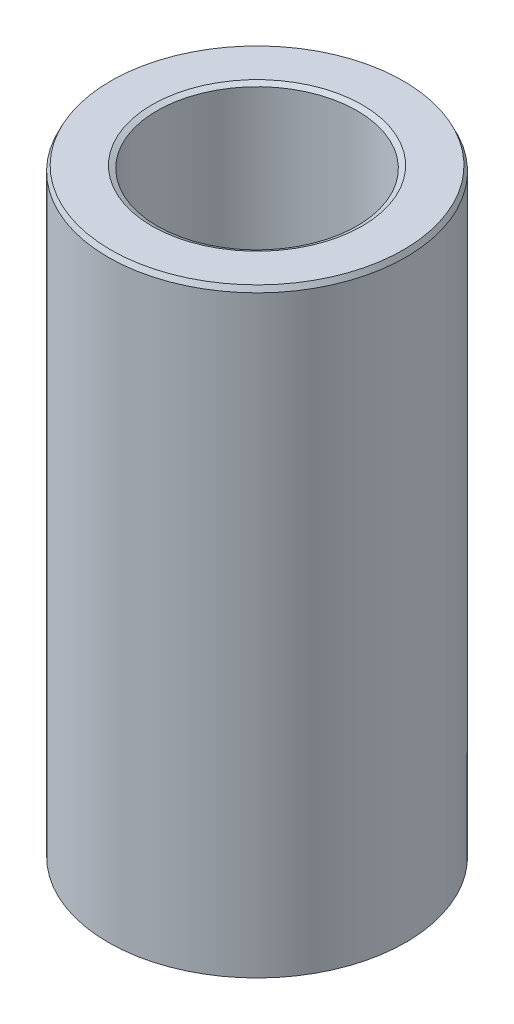
from build123d import *
from OCP.BRepFilletAPI import BRepFilletAPI_MakeChamfer

# Parameters (mm, degrees)
SKETCH1_R           = 50
BOSS_EXTRUDE1_DEPTH = 201.895542039
SKETCH2_R           = 33.577396737
CUT_EXTRUDE1_DEPTH  = 214.920101662
CHAMFER1_SIZE       = 1.7305693
CHAMFER1_SIZE2      = 0.84217697


with BuildPart() as part:
    # Sketch1 → Boss-Extrude1 (new body)
    with BuildSketch(Plane(origin=(0, 0, 0), x_dir=(1, 0, 0), z_dir=(0, 1, 0))):
        Circle(SKETCH1_R)
    extrude(amount=BOSS_EXTRUDE1_DEPTH)

    # Sketch2 → Cut-Extrude1 (cut, through all)
    with BuildSketch(Plane(origin=(0, 0, 0), x_dir=(1, 0, 0), z_dir=(0, 1, 0))):
        Circle(SKETCH2_R)
    extrude(amount=CUT_EXTRUDE1_DEPTH, mode=Mode.SUBTRACT)

    # Chamfer1: one chamfer whose edges measure the first distance from different faces: ONE call of the kernel's chamfer builder (chamfer() names one face for all edges)
    chamfer1_edges_1 = [part.edges().sort_by_distance(p)[0] for p in [
        (-33.577396737, 201.895542039, 0),
    ]]
    chamfer1_side_1 = [part.faces().sort_by_distance(p)[0] for p in [
        (-48.585786438, 201.895542039, 0),
    ]]
    chamfer1_edges_2 = [part.edges().sort_by_distance(p)[0] for p in [
        (-33.577396737, 0, 0),
    ]]
    chamfer1_side_2 = [part.faces().sort_by_distance(p)[0] for p in [
        (-33.577396737, 100.947771019, 0),
    ]]
    chamfer1_edges_3 = [part.edges().sort_by_distance(p)[0] for p in [
        (-50, 0, 0),
    ]]
    chamfer1_side_3 = [part.faces().sort_by_distance(p)[0] for p in [
        (-48.585786438, 0, 0),
    ]]
    chamfer1_edges_4 = [part.edges().sort_by_distance(p)[0] for p in [
        (-50, 201.895542039, 0),
    ]]
    chamfer1_side_4 = [part.faces().sort_by_distance(p)[0] for p in [
        (-50, 100.947771019, 0),
    ]]
    chamfer1 = BRepFilletAPI_MakeChamfer(part.part.solid().wrapped)
    for e in chamfer1_edges_1:
        chamfer1.Add(CHAMFER1_SIZE, CHAMFER1_SIZE2, e.wrapped, chamfer1_side_1[0].wrapped)  # the first distance lies on this face
    for e in chamfer1_edges_2:
        chamfer1.Add(CHAMFER1_SIZE, CHAMFER1_SIZE2, e.wrapped, chamfer1_side_2[0].wrapped)  # the first distance lies on this face
    for e in chamfer1_edges_3:
        chamfer1.Add(CHAMFER1_SIZE, CHAMFER1_SIZE2, e.wrapped, chamfer1_side_3[0].wrapped)  # the first distance lies on this face
    for e in chamfer1_edges_4:
        chamfer1.Add(CHAMFER1_SIZE, CHAMFER1_SIZE2, e.wrapped, chamfer1_side_4[0].wrapped)  # the first distance lies on this face
    add(Compound.cast(chamfer1.Shape()), mode=Mode.REPLACE)


solid = part.part
